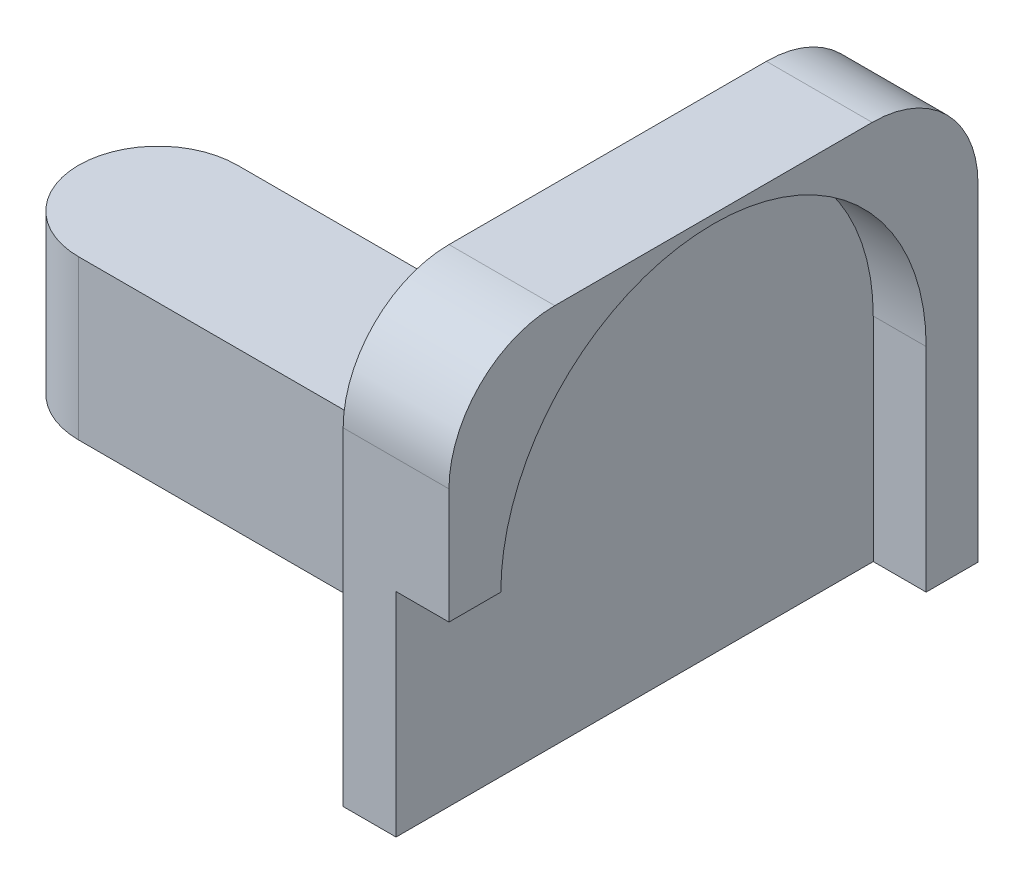
from build123d import *

# Parameters (mm, degrees)
SKETCH1_W           = 50
SKETCH1_H           = 41
BOSS_EXTRUDE1_DEPTH = 5
SKETCH2_W           = 15
SKETCH2_H           = 15
BOSS_EXTRUDE2_DEPTH = 50
BOSS_EXTRUDE3_DEPTH = 5
FILLET1_START       = -20.5
FILLET1_DEPTH       = 41
FILLET1_2_DEPTH     = 15
FILLET2_R           = 10


with BuildPart() as part:
    # Sketch1 → Boss-Extrude1 (new body)
    with BuildSketch(Plane(origin=(0, 0, 0), x_dir=(0, 0, -1), z_dir=(1, 0, 0))):
        Rectangle(SKETCH1_W, SKETCH1_H)
    extrude(amount=BOSS_EXTRUDE1_DEPTH)

    # Sketch2 → Boss-Extrude2 (add)
    with BuildSketch(Plane.ZY):
        with Locations((0, -13)):
            Rectangle(SKETCH2_W, SKETCH2_H)
    extrude(amount=BOSS_EXTRUDE2_DEPTH)

    # Sketch3 → Boss-Extrude3 (add)
    with BuildSketch(Plane(origin=(5, 0, 0), x_dir=(0, 0, -1), z_dir=(1, 0, 0))):
        with BuildLine():
            Line((25, 20.5), (-25, 20.5))
            Line((-25, 20.5), (-25, -0.4))
            Line((-25, -0.4), (-20.1, -0.4))
            ThreePointArc((-20.1, -0.4), (0, 19.7), (20.1, -0.4))
            Line((20.1, -0.4), (20.1, -20.5))
            Line((20.1, -20.5), (25, -20.5))
            Line((25, -20.5), (25, 20.5))
        make_face()
    extrude(amount=BOSS_EXTRUDE3_DEPTH)

    # Fillet1: read off the stored shape, not the designer's step
    # Fillet1 outline → Fillet1 (cut)
    with BuildSketch(Plane(origin=(0, 0, 0), x_dir=(1, 0, 0), z_dir=(0, 1, 0)).offset(FILLET1_START)):
        with BuildLine():
            Line((-50, 7.5), (-50, 0))
            ThreePointArc((-50, 0), (-47.803300859, 5.303300859), (-42.5, 7.5))
            Line((-42.5, 7.5), (-50, 7.5))
        make_face()
        with BuildLine():
            ThreePointArc((-42.5, -7.5), (-47.803300859, -5.303300859), (-50, 0))
            Line((-50, 0), (-50, -7.5))
            Line((-50, -7.5), (-42.5, -7.5))
        make_face()
    extrude(amount=FILLET1_DEPTH, mode=Mode.SUBTRACT)

    # Fillet1 2 outline → Fillet1 2 (add)
    with BuildSketch(Plane(origin=(0, 0, 0), x_dir=(1, 0, 0), z_dir=(0, 1, 0)).offset(FILLET1_START)):
        with BuildLine():
            Line((0, -7.5), (-7.5, -7.5))
            ThreePointArc((-7.5, -7.5), (-2.196699141, -9.696699141), (0, -15))
            Line((0, -15), (0, -7.5))
        make_face()
        with BuildLine():
            ThreePointArc((0, 15), (-2.196699141, 9.696699141), (-7.5, 7.5))
            Line((-7.5, 7.5), (0, 7.5))
            Line((0, 7.5), (0, 15))
        make_face()
    extrude(amount=FILLET1_2_DEPTH)

    # Fillet2
    fillet2_edges = [part.edges().sort_by_distance(p)[0] for p in [
        (5, 20.5, 25),
        (5, 20.5, -25),
    ]]
    fillet(fillet2_edges, radius=FILLET2_R)


solid = part.part
